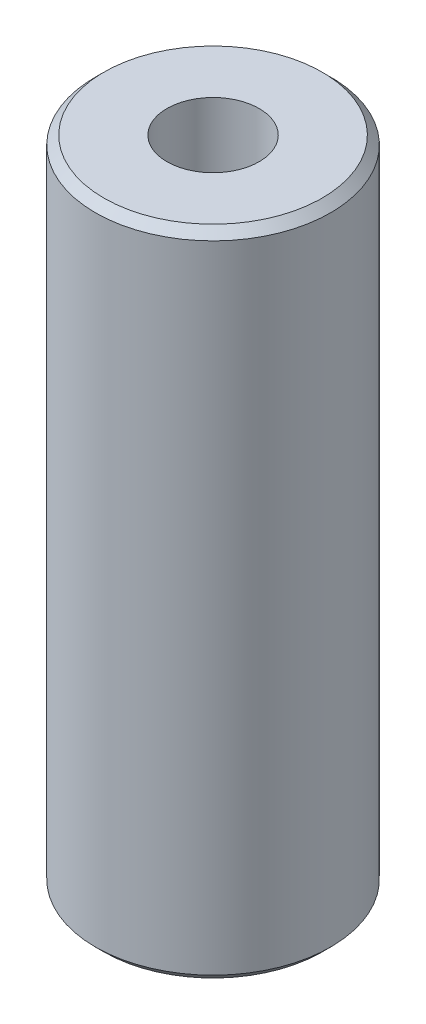
from build123d import *

# Parameters (mm, degrees)
SKETCH1_R           = 37.5
BOSS_EXTRUDE1_DEPTH = 208.158488537
SKETCH2_R           = 14.705731176
CUT_EXTRUDE1_DEPTH  = 215.807952251
CHAMFER1_SIZE       = 2.700096858


with BuildPart() as part:
    # Sketch1 → Boss-Extrude1 (new body)
    with BuildSketch(Plane(origin=(0, 0, 0), x_dir=(1, 0, 0), z_dir=(0, 1, 0))):
        Circle(SKETCH1_R)
    extrude(amount=BOSS_EXTRUDE1_DEPTH)

    # Sketch2 → Cut-Extrude1 (cut, through all)
    with BuildSketch(Plane(origin=(0, 0, 0), x_dir=(1, 0, 0), z_dir=(0, 1, 0))):
        Circle(SKETCH2_R)
    extrude(amount=CUT_EXTRUDE1_DEPTH, mode=Mode.SUBTRACT)

    # Chamfer1
    chamfer1_edges = [part.edges().sort_by_distance(p)[0] for p in [
        (-37.5, 208.158488537, 0),
        (-37.5, 0, 0),
    ]]
    chamfer(chamfer1_edges, length=CHAMFER1_SIZE)


solid = part.part
